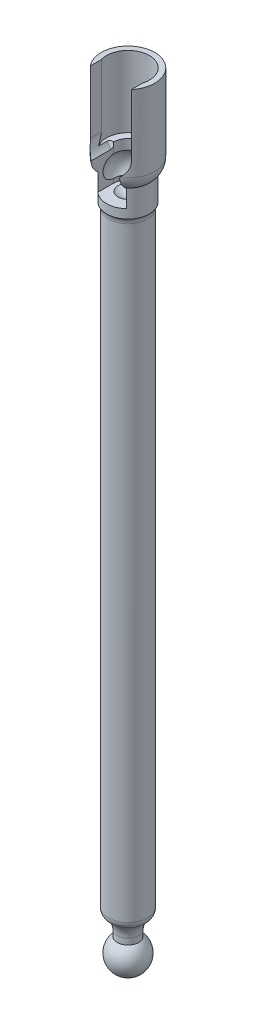
from build123d import *

# Parameters (mm, degrees)
ESBO_O2_R                     = 6
RESSALTO_EXTRUS_O1_DEPTH      = 20
ESBO_O3_R                     = 11
RESSALTO_EXTRUS_O2_DEPTH      = 350
FILETE1_R                     = 10
FILETE2_R                     = 5
RESSALTO_EXTRUS_O3_DEPTH      = 20
RESSALTO_EXTRUS_O4_START      = -5
ESBO_O7_R                     = 12
RESSALTO_EXTRUS_O4_DEPTH      = 5
FILETE3_R                     = 5
RESSALTO_EXTRUS_O5_DEPTH      = 40
RESSALTO_EXTRUS_O5_DEPTH_BACK = 10
FILETE4_R                     = 10
ESBO_O11_W                    = 23
ESBO_O11_H                    = 42.858571571
CORTE_EXTRUS_O3_DEPTH         = 40
FILETE5_R                     = 10
FILETE6_R                     = 1.5


with BuildPart() as part:
    # Esboço1 → Revolução1 (revolve)
    with BuildSketch(Plane.XY):
        with BuildLine():
            Line((-10, 0), (10, 0))
            ThreePointArc((10, 0), (0, 10), (-10, 0))
        make_face()
    revolve(axis=Axis((-10, 0, 0), (1, 0, 0)))

    # Esboço2 → Ressalto-extrusão1 (add)
    with BuildSketch(Plane(origin=(0, 0, 0), x_dir=(1, 0, 0), z_dir=(0, 1, 0))):
        with Locations(Location((0, 0, 0), (0, 0, 90))):
            Circle(ESBO_O2_R)
    extrude(amount=RESSALTO_EXTRUS_O1_DEPTH)

    # Esboço3 → Ressalto-extrusão2 (add)
    with BuildSketch(Plane(origin=(0, 20, 0), x_dir=(1, 0, 0), z_dir=(0, 1, 0))):
        with Locations(Location((0, 0, 0), (0, 0, 270))):
            Circle(ESBO_O3_R)
    extrude(amount=RESSALTO_EXTRUS_O2_DEPTH)

    # Filete1
    # the kernel refuses this fillet: 10 mm, written as the material it adds along each edge
    with BuildSketch(Plane(origin=(0, 20, 0), x_dir=(0, 0, -1), z_dir=(1, 0, 0))) as filete1_piece_1:
        with BuildLine():
            CenterArc((16, -8.660254038), FILETE1_R, 120, 60)
            Line((6, -8.660254038), (5.8, -8.660254038))
            Line((5.8, -8.660254038), (5.8, 0))
            Line((5.8, 0), (6, 0.2))
            ThreePointArc((6, 0.2), (8.5, 0.2), (10.9, 0.173205081))
            Line((10.9, 0.173205081), (11, 0))
        make_face()
    revolve(axis=Axis((0, 20, 0), (0, 1, 0)))

    # Filete2
    filete2_edges = [part.edges().sort_by_distance(p)[0] for p in [
        (11, 20, 0),
    ]]
    fillet(filete2_edges, radius=FILETE2_R)

    # Esboço5 → Ressalto-extrusão3 (add)
    with BuildSketch(Plane(origin=(0, 370, 0), x_dir=(1, 0, 0), z_dir=(0, 1, 0))):
        with BuildLine():
            Line((-8, -8.94427191), (-8, 0))
            ThreePointArc((-8, 0), (0, 8), (8, 0))
            Line((8, 0), (8, -8.94427191))
            ThreePointArc((8, -8.94427191), (12, 0), (8, 8.94427191))
            ThreePointArc((8, 8.94427191), (0, 12), (-8, 8.94427191))
            ThreePointArc((-8, 8.94427191), (-12, 0), (-8, -8.94427191))
        make_face()
    extrude(amount=RESSALTO_EXTRUS_O3_DEPTH)

    # Esboço7 → Ressalto-extrusão4 (add)
    with BuildSketch(Plane(origin=(0, 370, 0), x_dir=(1, 0, 0), z_dir=(0, 1, 0)).offset(RESSALTO_EXTRUS_O4_START)):
        with Locations(Location((0, 0, 0), (0, 0, 311.810314896))):
            Circle(ESBO_O7_R)
    extrude(amount=RESSALTO_EXTRUS_O4_DEPTH)

    # Filete3
    # the kernel refuses this fillet: 5 mm, written as the material it adds along each edge
    with BuildSketch(Plane(origin=(0, 365, 0), x_dir=(0, 0, 1), z_dir=(1, 0, 0))) as filete3_piece_1:
        with BuildLine():
            CenterArc((16, 3), FILETE3_R, 180, 36.869897646)
            Line((12, 0), (11.92, -0.06))
            ThreePointArc((11.92, -0.06), (11.5, -0.1), (11, -0.1))
            Line((11, -0.1), (10.9, 0))
            Line((10.9, 0), (10.9, 3))
            Line((10.9, 3), (11, 3))
        make_face()
    revolve(axis=Axis((0, 365, 0), (0, -1, 0)))

    # Esboço8 → Corte-Revolução1 (revolve, cut)
    with BuildSketch(Plane.XY):
        with BuildLine():
            Line((0, 368.32023385), (0, 388.32023385))
            ThreePointArc((0, 388.32023385), (-10, 378.32023385), (0, 368.32023385))
        make_face()
    revolve(axis=Axis((0, 368.32023385, 0), (0, 1, 0)), mode=Mode.SUBTRACT)

    # Esboço10 → Ressalto-extrusão5 (add, two sides: drawn at the far end of the back side and taken through both)
    with BuildSketch(Plane(origin=(0, 390, 0), x_dir=(1, 0, 0), z_dir=(0, 1, 0)).offset(-RESSALTO_EXTRUS_O5_DEPTH_BACK)):
        with BuildLine():
            Line((-8, -8.94427191), (-8, -12.68857754))
            ThreePointArc((-8, -12.68857754), (0, 15), (8, -12.68857754))
            Line((8, -12.68857754), (8, -8.94427191))
            ThreePointArc((8, -8.94427191), (0, 12), (-8, -8.94427191))
        make_face()
    extrude(amount=RESSALTO_EXTRUS_O5_DEPTH + RESSALTO_EXTRUS_O5_DEPTH_BACK)

    # Filete4
    # the kernel refuses this fillet: 10 mm, written as the material it takes off along each edge
    with BuildSketch(Plane(origin=(0, 380, 0), x_dir=(-0.003141587485879309, 0, 0.9999950652018582), z_dir=(0.9999950652018582, 0, 0.003141587485879309))) as filete4_piece_1:
        with BuildLine():
            CenterArc((5, -7.141428429), FILETE4_R, 0, 45.572995999)
            Line((15, -7.141428429), (15, 0))
            Line((15, 0), (12, 0))
        make_face()
    revolve(axis=Axis((0, 380, 0), (0, -1, 0)), revolution_arc=359.64, mode=Mode.SUBTRACT)

    # Esboço11 → Corte-extrusão3 (cut)
    with BuildSketch(Plane.XY):
        with Locations((0, 408.570714215)):
            Rectangle(ESBO_O11_W, ESBO_O11_H)
    extrude(amount=CORTE_EXTRUS_O3_DEPTH, mode=Mode.SUBTRACT)

    # Filete5
    # the kernel refuses this fillet: 10 mm, written as the material it adds along each edge
    with BuildSketch(Plane(origin=(11.5, 387.141428429, -18.998355192), x_dir=(-1, 0, 0), z_dir=(0, 0, 1))) as filete5_piece_1_section:
        with BuildLine():
            CenterArc((10, -7.599342077), FILETE5_R, 130.541601874, 49.458398126)
            Line((0, -7.599342077), (0, 0))
            Line((0, 0), (3.5, 0))
        make_face()
    filete5_piece_1 = extrude(amount=47.627390526, mode=Mode.PRIVATE)
    filete5_piece_1 = filete5_piece_1 & Plane(origin=(0, 388.451461542, 0), x_dir=(-0.5333333333333332, 0, 0.8459051693633014), z_dir=(0, -1, 0)) * Cylinder(15, 126, mode=Mode.PRIVATE)
    filete5_piece_1 = split(filete5_piece_1, bisect_by=Plane(origin=(9.300320043, 390, 4.472135955), z_dir=(0, -1, 0)), keep=Keep.TOP, mode=Mode.PRIVATE)
    add(filete5_piece_1)
    with BuildSketch(Plane(origin=(11.5, 387.141428429, -18.998355192), x_dir=(-1, 0, 0), z_dir=(0, 0, 1))) as filete5_piece_2_section:
        with BuildLine():
            CenterArc((10, -7.599342077), FILETE5_R, 130.541601874, 49.458398126)
            Line((0, -7.599342077), (0, 0))
            Line((0, 0), (3.5, 0))
        make_face()
    filete5_piece_2 = extrude(amount=47.627390526, mode=Mode.PRIVATE)
    filete5_piece_2 = filete5_piece_2 & Plane(origin=(0, 392.291329927, 0), x_dir=(-0.5333333333333332, 0, 0.8459051693633014), z_dir=(0, -1, 0)) * Cylinder(15, 126, mode=Mode.PRIVATE)
    filete5_piece_2 = filete5_piece_2 - Plane(origin=(0, 392.291329927, 0), x_dir=(0.666666666666667, 0, 0.7453559924999297), z_dir=(0, -1, 0)) * Cylinder(12, 126, mode=Mode.PRIVATE)
    add(filete5_piece_2)
    with BuildSketch(Plane(origin=(-11.5, 387.141428429, -18.998355192), x_dir=(1, 0, 0), z_dir=(0, 0, 1))) as filete5_piece_3_section:
        with BuildLine():
            CenterArc((10, 7.599342077), FILETE5_R, 180, 49.458398126)
            Line((0, 7.599342077), (0, 0))
            Line((0, 0), (3.5, 0))
        make_face()
    filete5_piece_3 = extrude(amount=47.627390526, mode=Mode.PRIVATE)
    filete5_piece_3 = filete5_piece_3 & Plane(origin=(0, 388.451461532, 0), x_dir=(-0.5333333333333332, 0, 0.8459051693633014), z_dir=(0, -1, 0)) * Cylinder(15, 126, mode=Mode.PRIVATE)
    filete5_piece_3 = split(filete5_piece_3, bisect_by=Plane(origin=(-9.300320034, 390, 4.472135955), z_dir=(0, -1, 0)), keep=Keep.TOP, mode=Mode.PRIVATE)
    add(filete5_piece_3)
    with BuildSketch(Plane(origin=(-11.5, 387.141428429, -18.998355192), x_dir=(1, 0, 0), z_dir=(0, 0, 1))) as filete5_piece_4_section:
        with BuildLine():
            CenterArc((10, 7.599342077), FILETE5_R, 180, 49.458398126)
            Line((0, 7.599342077), (0, 0))
            Line((0, 0), (3.5, 0))
        make_face()
    filete5_piece_4 = extrude(amount=47.627390526, mode=Mode.PRIVATE)
    filete5_piece_4 = filete5_piece_4 & Plane(origin=(0, 392.291329925, 0), x_dir=(-0.5333333333333332, 0, 0.8459051693633014), z_dir=(0, -1, 0)) * Cylinder(15, 126, mode=Mode.PRIVATE)
    filete5_piece_4 = filete5_piece_4 - Plane(origin=(0, 392.291329925, 0), x_dir=(0.666666666666667, 0, 0.7453559924999297), z_dir=(0, -1, 0)) * Cylinder(12, 126, mode=Mode.PRIVATE)
    add(filete5_piece_4)

    # Filete6
    filete6_edges = [part.edges().sort_by_distance(p)[0] for p in [
        (9.284750533, 388.464015043, 0),
        (-9.284750533, 388.464015043, 0),
    ]]
    fillet(filete6_edges, radius=FILETE6_R)


solid = part.part
